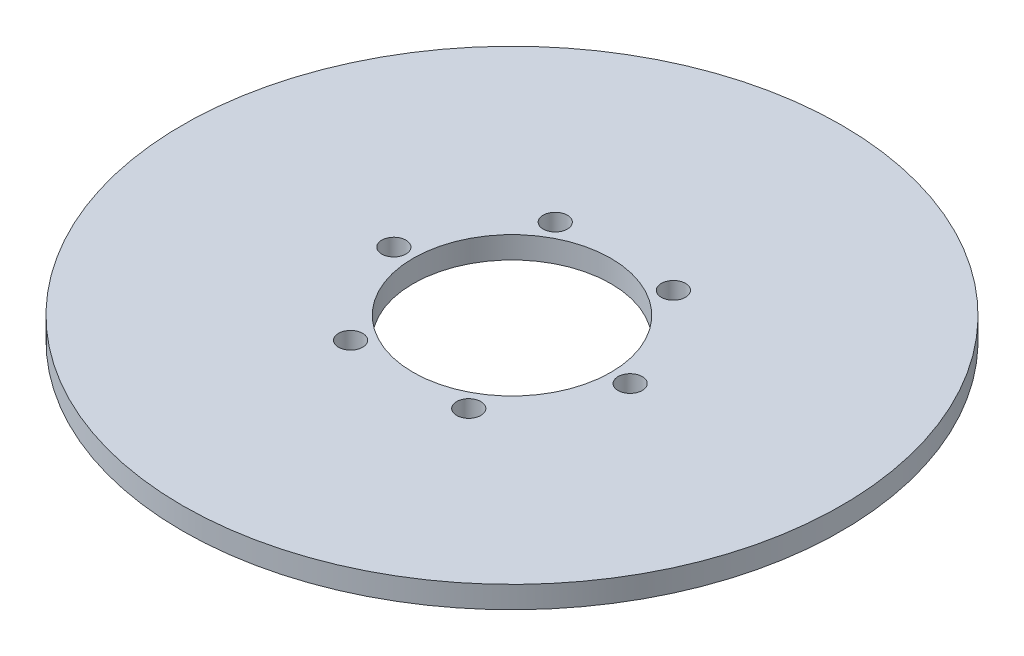
from build123d import *

# Parameters (mm, degrees)
SKETCH1_R           = 75
BOSS_EXTRUDE1_DEPTH = 5
SKETCH2_R           = 22.5
CUT_EXTRUDE1_DEPTH  = 107.183802908
SKETCH3_R           = 2.75290013
CUT_EXTRUDE2_DEPTH  = 4.481709637
CIRPATTERN1_COUNT   = 6


with BuildPart() as part:
    # Sketch1 → Boss-Extrude1 (new body)
    with BuildSketch(Plane(origin=(0, 0, 0), x_dir=(1, 0, 0), z_dir=(0, 1, 0))):
        Circle(SKETCH1_R)
    extrude(amount=BOSS_EXTRUDE1_DEPTH)

    # Sketch2 → Cut-Extrude1 (cut, through all)
    with BuildSketch(Plane(origin=(0, 0, 0), x_dir=(1, 0, 0), z_dir=(0, 1, 0))):
        Circle(SKETCH2_R)
    extrude(amount=CUT_EXTRUDE1_DEPTH, mode=Mode.SUBTRACT)

    # Sketch3 → Cut-Extrude2 (cut)
    with BuildSketch(Plane(origin=(0, 5, 0), x_dir=(1, 0, 0), z_dir=(0, 1, 0))):
        with Locations((-26.891400655, 0)):
            Circle(SKETCH3_R)
    cut_extrude2 = extrude(amount=-CUT_EXTRUDE2_DEPTH, mode=Mode.SUBTRACT)

    # CirPattern1: Cut-Extrude2 ×6 about axis
    cirpattern1_axis = Axis((0, 0, 0), (0, 1, 0))
    for i in range(1, CIRPATTERN1_COUNT):
        add(cut_extrude2.rotate(cirpattern1_axis, i * 360 / CIRPATTERN1_COUNT), mode=Mode.SUBTRACT)


solid = part.part
